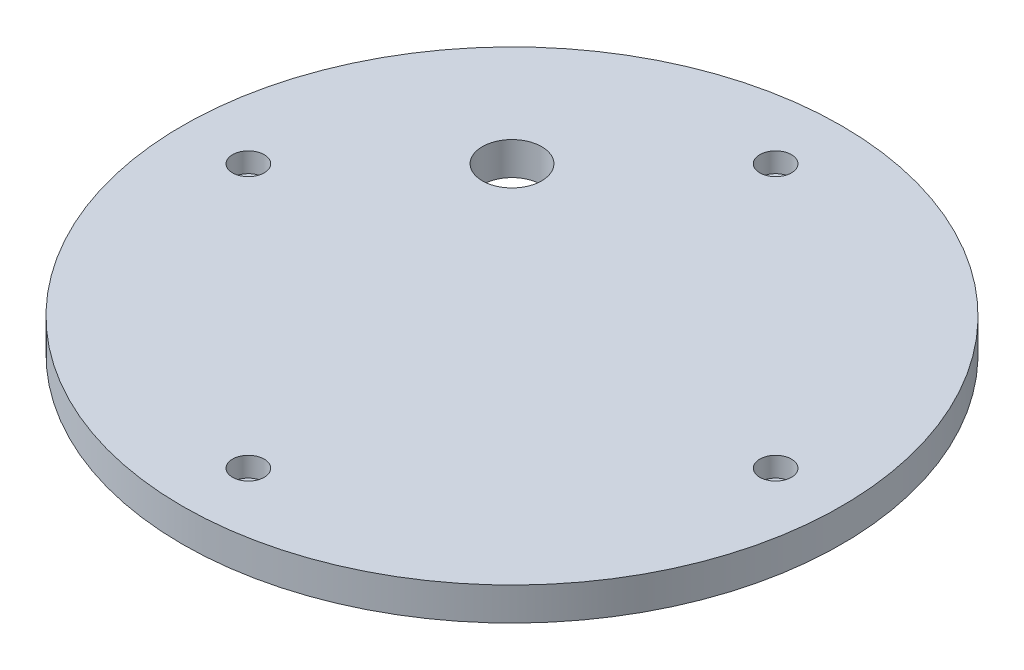
from build123d import *

# Parameters (mm, degrees)
SKETCH_1_R          = 50
EXTRUDE_1_DEPTH     = 5
SKETCH_4_R          = 2.4
CUT_EXTRUDE_2_DEPTH = 3
SKETCH_5_R          = 4.5
CUT_EXTRUDE_3_DEPTH = 10
SKETCH_10_R         = 2.75
CUT_EXTRUDE_5_DEPTH = 4


with BuildPart() as part:
    # 草图1 → 凸台-拉伸1 (new body)
    with BuildSketch(Plane(origin=(0, 0, 0), x_dir=(1, 0, 0), z_dir=(0, 1, 0))):
        Circle(SKETCH_1_R)
    extrude(amount=EXTRUDE_1_DEPTH)

    # 草图4 → 切除-拉伸2 (cut)
    with BuildSketch(Plane(origin=(0, 5, 0), x_dir=(1, 0, 0), z_dir=(0, 1, 0))):
        with Locations((0, 40)):
            Circle(SKETCH_4_R)
        with Locations((40, 0)):
            Circle(SKETCH_4_R)
        with Locations((0, -40)):
            Circle(SKETCH_4_R)
        with Locations((-40, 0)):
            Circle(SKETCH_4_R)
    extrude(amount=-CUT_EXTRUDE_2_DEPTH, mode=Mode.SUBTRACT)

    # 草图5 → 切除-拉伸3 (cut)
    with BuildSketch(Plane(origin=(0, 5, 0), x_dir=(1, 0, 0), z_dir=(0, 1, 0))):
        with Locations((-20, 20)):
            Circle(SKETCH_5_R)
    extrude(amount=-CUT_EXTRUDE_3_DEPTH, mode=Mode.SUBTRACT)

    # 草图10 → 切除-拉伸5 (cut)
    with BuildSketch(Plane.XZ):
        with Locations((28.74171217, 0)):
            Circle(SKETCH_10_R)
        with Locations((0, -28.74171217)):
            Circle(SKETCH_10_R)
        with Locations((-28.74171217, 0)):
            Circle(SKETCH_10_R)
        with Locations((0, 28.74171217)):
            Circle(SKETCH_10_R)
    extrude(amount=-CUT_EXTRUDE_5_DEPTH, mode=Mode.SUBTRACT)


solid = part.part
